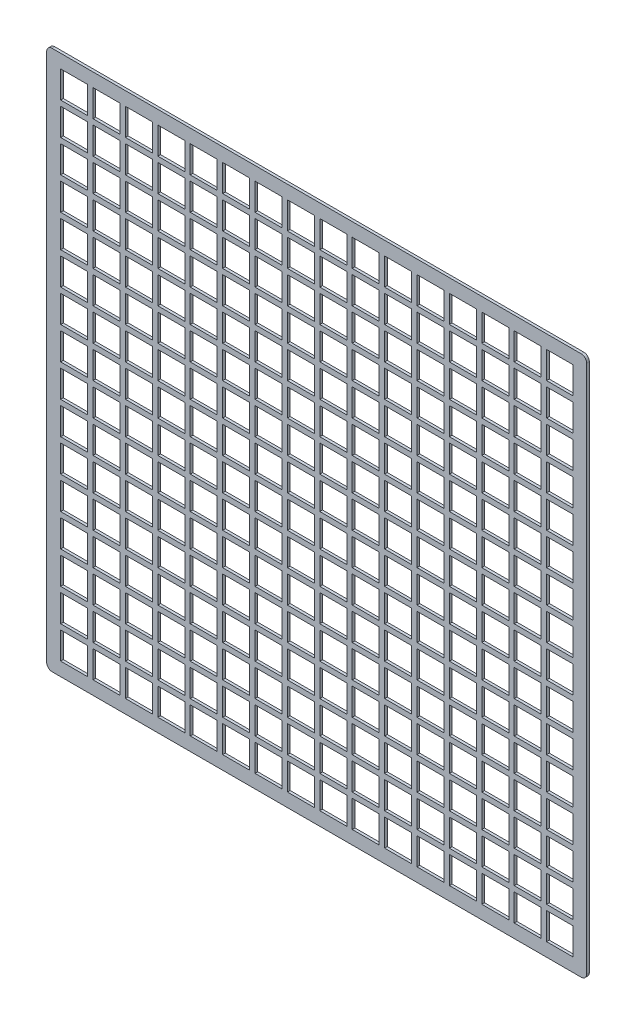
from build123d import *

# Parameters (mm, degrees)
MODEL_W             = 0.5
MODEL_H             = 0.499061554
MODEL_H_2           = 0.5
MODEL_W_2           = 0.491377323
BOSS_EXTRUDE1_DEPTH = 0.05


with BuildPart() as part:
    # Model → Boss-Extrude1 (new body)
    with BuildSketch(Plane.XY):
        with BuildLine():
            Line((0.1, 0), (9.9, 0))
            ThreePointArc((9.9, 0), (9.970710678, 0.029289322), (10, 0.1))
            Line((10, 0.1), (10, 9.9))
            ThreePointArc((10, 9.9), (9.970710678, 9.970710678), (9.9, 10))
            Line((9.9, 10), (0.1, 10))
            ThreePointArc((0.1, 10), (0.029289322, 9.970710678), (0, 9.9))
            Line((0, 9.9), (0, 0.1))
            ThreePointArc((0, 0.1), (0.029289322, 0.029289322), (0.1, 0))
        make_face()
        with Locations((0.508622677, 0.499530777)):
            Rectangle(MODEL_W, MODEL_H, mode=Mode.SUBTRACT)
        with Locations((0.508622677, 1.099061554)):
            Rectangle(MODEL_W, MODEL_H_2, mode=Mode.SUBTRACT)
        with Locations((0.508622677, 1.699061554)):
            Rectangle(MODEL_W, MODEL_H_2, mode=Mode.SUBTRACT)
        with Locations((0.508622677, 2.299061554)):
            Rectangle(MODEL_W, MODEL_H_2, mode=Mode.SUBTRACT)
        with Locations((0.508622677, 2.899061554)):
            Rectangle(MODEL_W, MODEL_H_2, mode=Mode.SUBTRACT)
        with Locations((0.508622677, 3.499061554)):
            Rectangle(MODEL_W, MODEL_H_2, mode=Mode.SUBTRACT)
        with Locations((0.508622677, 4.099061554)):
            Rectangle(MODEL_W, MODEL_H_2, mode=Mode.SUBTRACT)
        with Locations((0.508622677, 4.699061554)):
            Rectangle(MODEL_W, MODEL_H_2, mode=Mode.SUBTRACT)
        with Locations((0.508622677, 5.299061554)):
            Rectangle(MODEL_W, MODEL_H_2, mode=Mode.SUBTRACT)
        with Locations((0.508622677, 5.899061554)):
            Rectangle(MODEL_W, MODEL_H_2, mode=Mode.SUBTRACT)
        with Locations((0.508622677, 6.499061554)):
            Rectangle(MODEL_W, MODEL_H_2, mode=Mode.SUBTRACT)
        with Locations((0.508622677, 7.099061554)):
            Rectangle(MODEL_W, MODEL_H_2, mode=Mode.SUBTRACT)
        with Locations((0.508622677, 7.699061554)):
            Rectangle(MODEL_W, MODEL_H_2, mode=Mode.SUBTRACT)
        with Locations((0.508622677, 8.299061554)):
            Rectangle(MODEL_W, MODEL_H_2, mode=Mode.SUBTRACT)
        with Locations((0.508622677, 8.899061554)):
            Rectangle(MODEL_W, MODEL_H_2, mode=Mode.SUBTRACT)
        with Locations((0.508622677, 9.499061554)):
            Rectangle(MODEL_W, MODEL_H_2, mode=Mode.SUBTRACT)
        with Locations((1.108622677, 0.499530777)):
            Rectangle(MODEL_W, MODEL_H, mode=Mode.SUBTRACT)
        with Locations((1.108622677, 1.099061554)):
            Rectangle(MODEL_W, MODEL_H_2, mode=Mode.SUBTRACT)
        with Locations((1.108622677, 1.699061554)):
            Rectangle(MODEL_W, MODEL_H_2, mode=Mode.SUBTRACT)
        with Locations((1.108622677, 2.299061554)):
            Rectangle(MODEL_W, MODEL_H_2, mode=Mode.SUBTRACT)
        with Locations((1.108622677, 2.899061554)):
            Rectangle(MODEL_W, MODEL_H_2, mode=Mode.SUBTRACT)
        with Locations((1.108622677, 3.499061554)):
            Rectangle(MODEL_W, MODEL_H_2, mode=Mode.SUBTRACT)
        with Locations((1.108622677, 4.099061554)):
            Rectangle(MODEL_W, MODEL_H_2, mode=Mode.SUBTRACT)
        with Locations((1.108622677, 4.699061554)):
            Rectangle(MODEL_W, MODEL_H_2, mode=Mode.SUBTRACT)
        with Locations((1.108622677, 5.299061554)):
            Rectangle(MODEL_W, MODEL_H_2, mode=Mode.SUBTRACT)
        with Locations((1.108622677, 5.899061554)):
            Rectangle(MODEL_W, MODEL_H_2, mode=Mode.SUBTRACT)
        with Locations((1.108622677, 6.499061554)):
            Rectangle(MODEL_W, MODEL_H_2, mode=Mode.SUBTRACT)
        with Locations((1.108622677, 7.099061554)):
            Rectangle(MODEL_W, MODEL_H_2, mode=Mode.SUBTRACT)
        with Locations((1.108622677, 7.699061554)):
            Rectangle(MODEL_W, MODEL_H_2, mode=Mode.SUBTRACT)
        with Locations((1.108622677, 8.299061554)):
            Rectangle(MODEL_W, MODEL_H_2, mode=Mode.SUBTRACT)
        with Locations((1.108622677, 8.899061554)):
            Rectangle(MODEL_W, MODEL_H_2, mode=Mode.SUBTRACT)
        with Locations((1.108622677, 9.499061554)):
            Rectangle(MODEL_W, MODEL_H_2, mode=Mode.SUBTRACT)
        with Locations((1.708622677, 0.499530777)):
            Rectangle(MODEL_W, MODEL_H, mode=Mode.SUBTRACT)
        with Locations((1.708622677, 1.099061554)):
            Rectangle(MODEL_W, MODEL_H_2, mode=Mode.SUBTRACT)
        with Locations((1.708622677, 1.699061554)):
            Rectangle(MODEL_W, MODEL_H_2, mode=Mode.SUBTRACT)
        with Locations((1.708622677, 2.299061554)):
            Rectangle(MODEL_W, MODEL_H_2, mode=Mode.SUBTRACT)
        with Locations((1.708622677, 2.899061554)):
            Rectangle(MODEL_W, MODEL_H_2, mode=Mode.SUBTRACT)
        with Locations((1.708622677, 3.499061554)):
            Rectangle(MODEL_W, MODEL_H_2, mode=Mode.SUBTRACT)
        with Locations((1.708622677, 4.099061554)):
            Rectangle(MODEL_W, MODEL_H_2, mode=Mode.SUBTRACT)
        with Locations((1.708622677, 4.699061554)):
            Rectangle(MODEL_W, MODEL_H_2, mode=Mode.SUBTRACT)
        with Locations((1.708622677, 5.299061554)):
            Rectangle(MODEL_W, MODEL_H_2, mode=Mode.SUBTRACT)
        with Locations((1.708622677, 5.899061554)):
            Rectangle(MODEL_W, MODEL_H_2, mode=Mode.SUBTRACT)
        with Locations((1.708622677, 6.499061554)):
            Rectangle(MODEL_W, MODEL_H_2, mode=Mode.SUBTRACT)
        with Locations((1.708622677, 7.099061554)):
            Rectangle(MODEL_W, MODEL_H_2, mode=Mode.SUBTRACT)
        with Locations((1.708622677, 7.699061554)):
            Rectangle(MODEL_W, MODEL_H_2, mode=Mode.SUBTRACT)
        with Locations((1.708622677, 8.299061554)):
            Rectangle(MODEL_W, MODEL_H_2, mode=Mode.SUBTRACT)
        with Locations((1.708622677, 8.899061554)):
            Rectangle(MODEL_W, MODEL_H_2, mode=Mode.SUBTRACT)
        with Locations((1.708622677, 9.499061554)):
            Rectangle(MODEL_W, MODEL_H_2, mode=Mode.SUBTRACT)
        with Locations((2.308622677, 0.499530777)):
            Rectangle(MODEL_W, MODEL_H, mode=Mode.SUBTRACT)
        with Locations((2.308622677, 1.099061554)):
            Rectangle(MODEL_W, MODEL_H_2, mode=Mode.SUBTRACT)
        with Locations((2.308622677, 1.699061554)):
            Rectangle(MODEL_W, MODEL_H_2, mode=Mode.SUBTRACT)
        with Locations((2.308622677, 2.299061554)):
            Rectangle(MODEL_W, MODEL_H_2, mode=Mode.SUBTRACT)
        with Locations((2.308622677, 2.899061554)):
            Rectangle(MODEL_W, MODEL_H_2, mode=Mode.SUBTRACT)
        with Locations((2.308622677, 3.499061554)):
            Rectangle(MODEL_W, MODEL_H_2, mode=Mode.SUBTRACT)
        with Locations((2.308622677, 4.099061554)):
            Rectangle(MODEL_W, MODEL_H_2, mode=Mode.SUBTRACT)
        with Locations((2.308622677, 4.699061554)):
            Rectangle(MODEL_W, MODEL_H_2, mode=Mode.SUBTRACT)
        with Locations((2.308622677, 5.299061554)):
            Rectangle(MODEL_W, MODEL_H_2, mode=Mode.SUBTRACT)
        with Locations((2.308622677, 5.899061554)):
            Rectangle(MODEL_W, MODEL_H_2, mode=Mode.SUBTRACT)
        with Locations((2.308622677, 6.499061554)):
            Rectangle(MODEL_W, MODEL_H_2, mode=Mode.SUBTRACT)
        with Locations((2.308622677, 7.099061554)):
            Rectangle(MODEL_W, MODEL_H_2, mode=Mode.SUBTRACT)
        with Locations((2.308622677, 7.699061554)):
            Rectangle(MODEL_W, MODEL_H_2, mode=Mode.SUBTRACT)
        with Locations((2.308622677, 8.299061554)):
            Rectangle(MODEL_W, MODEL_H_2, mode=Mode.SUBTRACT)
        with Locations((2.308622677, 8.899061554)):
            Rectangle(MODEL_W, MODEL_H_2, mode=Mode.SUBTRACT)
        with Locations((2.308622677, 9.499061554)):
            Rectangle(MODEL_W, MODEL_H_2, mode=Mode.SUBTRACT)
        with Locations((2.908622677, 0.499530777)):
            Rectangle(MODEL_W, MODEL_H, mode=Mode.SUBTRACT)
        with Locations((2.908622677, 1.099061554)):
            Rectangle(MODEL_W, MODEL_H_2, mode=Mode.SUBTRACT)
        with Locations((2.908622677, 1.699061554)):
            Rectangle(MODEL_W, MODEL_H_2, mode=Mode.SUBTRACT)
        with Locations((2.908622677, 2.299061554)):
            Rectangle(MODEL_W, MODEL_H_2, mode=Mode.SUBTRACT)
        with Locations((2.908622677, 2.899061554)):
            Rectangle(MODEL_W, MODEL_H_2, mode=Mode.SUBTRACT)
        with Locations((2.908622677, 3.499061554)):
            Rectangle(MODEL_W, MODEL_H_2, mode=Mode.SUBTRACT)
        with Locations((2.908622677, 4.099061554)):
            Rectangle(MODEL_W, MODEL_H_2, mode=Mode.SUBTRACT)
        with Locations((2.908622677, 4.699061554)):
            Rectangle(MODEL_W, MODEL_H_2, mode=Mode.SUBTRACT)
        with Locations((2.908622677, 5.299061554)):
            Rectangle(MODEL_W, MODEL_H_2, mode=Mode.SUBTRACT)
        with Locations((2.908622677, 5.899061554)):
            Rectangle(MODEL_W, MODEL_H_2, mode=Mode.SUBTRACT)
        with Locations((2.908622677, 6.499061554)):
            Rectangle(MODEL_W, MODEL_H_2, mode=Mode.SUBTRACT)
        with Locations((2.908622677, 7.099061554)):
            Rectangle(MODEL_W, MODEL_H_2, mode=Mode.SUBTRACT)
        with Locations((2.908622677, 7.699061554)):
            Rectangle(MODEL_W, MODEL_H_2, mode=Mode.SUBTRACT)
        with Locations((2.908622677, 8.299061554)):
            Rectangle(MODEL_W, MODEL_H_2, mode=Mode.SUBTRACT)
        with Locations((2.908622677, 8.899061554)):
            Rectangle(MODEL_W, MODEL_H_2, mode=Mode.SUBTRACT)
        with Locations((2.908622677, 9.499061554)):
            Rectangle(MODEL_W, MODEL_H_2, mode=Mode.SUBTRACT)
        with Locations((3.508622677, 0.499530777)):
            Rectangle(MODEL_W, MODEL_H, mode=Mode.SUBTRACT)
        with Locations((3.508622677, 1.099061554)):
            Rectangle(MODEL_W, MODEL_H_2, mode=Mode.SUBTRACT)
        with Locations((3.508622677, 1.699061554)):
            Rectangle(MODEL_W, MODEL_H_2, mode=Mode.SUBTRACT)
        with Locations((3.508622677, 2.299061554)):
            Rectangle(MODEL_W, MODEL_H_2, mode=Mode.SUBTRACT)
        with Locations((3.508622677, 2.899061554)):
            Rectangle(MODEL_W, MODEL_H_2, mode=Mode.SUBTRACT)
        with Locations((3.508622677, 3.499061554)):
            Rectangle(MODEL_W, MODEL_H_2, mode=Mode.SUBTRACT)
        with Locations((3.508622677, 4.099061554)):
            Rectangle(MODEL_W, MODEL_H_2, mode=Mode.SUBTRACT)
        with Locations((3.508622677, 4.699061554)):
            Rectangle(MODEL_W, MODEL_H_2, mode=Mode.SUBTRACT)
        with Locations((3.508622677, 5.299061554)):
            Rectangle(MODEL_W, MODEL_H_2, mode=Mode.SUBTRACT)
        with Locations((3.508622677, 5.899061554)):
            Rectangle(MODEL_W, MODEL_H_2, mode=Mode.SUBTRACT)
        with Locations((3.508622677, 6.499061554)):
            Rectangle(MODEL_W, MODEL_H_2, mode=Mode.SUBTRACT)
        with Locations((3.508622677, 7.099061554)):
            Rectangle(MODEL_W, MODEL_H_2, mode=Mode.SUBTRACT)
        with Locations((3.508622677, 7.699061554)):
            Rectangle(MODEL_W, MODEL_H_2, mode=Mode.SUBTRACT)
        with Locations((3.508622677, 8.299061554)):
            Rectangle(MODEL_W, MODEL_H_2, mode=Mode.SUBTRACT)
        with Locations((3.508622677, 8.899061554)):
            Rectangle(MODEL_W, MODEL_H_2, mode=Mode.SUBTRACT)
        with Locations((3.508622677, 9.499061554)):
            Rectangle(MODEL_W, MODEL_H_2, mode=Mode.SUBTRACT)
        with Locations((4.108622677, 0.499530777)):
            Rectangle(MODEL_W, MODEL_H, mode=Mode.SUBTRACT)
        with Locations((4.108622677, 1.099061554)):
            Rectangle(MODEL_W, MODEL_H_2, mode=Mode.SUBTRACT)
        with Locations((4.108622677, 1.699061554)):
            Rectangle(MODEL_W, MODEL_H_2, mode=Mode.SUBTRACT)
        with Locations((4.108622677, 2.299061554)):
            Rectangle(MODEL_W, MODEL_H_2, mode=Mode.SUBTRACT)
        with Locations((4.108622677, 2.899061554)):
            Rectangle(MODEL_W, MODEL_H_2, mode=Mode.SUBTRACT)
        with Locations((4.108622677, 3.499061554)):
            Rectangle(MODEL_W, MODEL_H_2, mode=Mode.SUBTRACT)
        with Locations((4.108622677, 4.099061554)):
            Rectangle(MODEL_W, MODEL_H_2, mode=Mode.SUBTRACT)
        with Locations((4.108622677, 4.699061554)):
            Rectangle(MODEL_W, MODEL_H_2, mode=Mode.SUBTRACT)
        with Locations((4.108622677, 5.299061554)):
            Rectangle(MODEL_W, MODEL_H_2, mode=Mode.SUBTRACT)
        with Locations((4.108622677, 5.899061554)):
            Rectangle(MODEL_W, MODEL_H_2, mode=Mode.SUBTRACT)
        with Locations((4.108622677, 6.499061554)):
            Rectangle(MODEL_W, MODEL_H_2, mode=Mode.SUBTRACT)
        with Locations((4.108622677, 7.099061554)):
            Rectangle(MODEL_W, MODEL_H_2, mode=Mode.SUBTRACT)
        with Locations((4.108622677, 7.699061554)):
            Rectangle(MODEL_W, MODEL_H_2, mode=Mode.SUBTRACT)
        with Locations((4.108622677, 8.299061554)):
            Rectangle(MODEL_W, MODEL_H_2, mode=Mode.SUBTRACT)
        with Locations((4.108622677, 8.899061554)):
            Rectangle(MODEL_W, MODEL_H_2, mode=Mode.SUBTRACT)
        with Locations((4.108622677, 9.499061554)):
            Rectangle(MODEL_W, MODEL_H_2, mode=Mode.SUBTRACT)
        with Locations((4.708622677, 0.499530777)):
            Rectangle(MODEL_W, MODEL_H, mode=Mode.SUBTRACT)
        with Locations((4.708622677, 1.099061554)):
            Rectangle(MODEL_W, MODEL_H_2, mode=Mode.SUBTRACT)
        with Locations((4.708622677, 1.699061554)):
            Rectangle(MODEL_W, MODEL_H_2, mode=Mode.SUBTRACT)
        with Locations((4.708622677, 2.299061554)):
            Rectangle(MODEL_W, MODEL_H_2, mode=Mode.SUBTRACT)
        with Locations((4.708622677, 2.899061554)):
            Rectangle(MODEL_W, MODEL_H_2, mode=Mode.SUBTRACT)
        with Locations((4.708622677, 3.499061554)):
            Rectangle(MODEL_W, MODEL_H_2, mode=Mode.SUBTRACT)
        with Locations((4.708622677, 4.099061554)):
            Rectangle(MODEL_W, MODEL_H_2, mode=Mode.SUBTRACT)
        with Locations((4.708622677, 4.699061554)):
            Rectangle(MODEL_W, MODEL_H_2, mode=Mode.SUBTRACT)
        with Locations((4.708622677, 5.299061554)):
            Rectangle(MODEL_W, MODEL_H_2, mode=Mode.SUBTRACT)
        with Locations((4.708622677, 5.899061554)):
            Rectangle(MODEL_W, MODEL_H_2, mode=Mode.SUBTRACT)
        with Locations((4.708622677, 6.499061554)):
            Rectangle(MODEL_W, MODEL_H_2, mode=Mode.SUBTRACT)
        with Locations((4.708622677, 7.099061554)):
            Rectangle(MODEL_W, MODEL_H_2, mode=Mode.SUBTRACT)
        with Locations((4.708622677, 7.699061554)):
            Rectangle(MODEL_W, MODEL_H_2, mode=Mode.SUBTRACT)
        with Locations((4.708622677, 8.299061554)):
            Rectangle(MODEL_W, MODEL_H_2, mode=Mode.SUBTRACT)
        with Locations((4.708622677, 8.899061554)):
            Rectangle(MODEL_W, MODEL_H_2, mode=Mode.SUBTRACT)
        with Locations((4.708622677, 9.499061554)):
            Rectangle(MODEL_W, MODEL_H_2, mode=Mode.SUBTRACT)
        with Locations((5.308622677, 0.499530777)):
            Rectangle(MODEL_W, MODEL_H, mode=Mode.SUBTRACT)
        with Locations((5.308622677, 1.099061554)):
            Rectangle(MODEL_W, MODEL_H_2, mode=Mode.SUBTRACT)
        with Locations((5.308622677, 1.699061554)):
            Rectangle(MODEL_W, MODEL_H_2, mode=Mode.SUBTRACT)
        with Locations((5.308622677, 2.299061554)):
            Rectangle(MODEL_W, MODEL_H_2, mode=Mode.SUBTRACT)
        with Locations((5.308622677, 2.899061554)):
            Rectangle(MODEL_W, MODEL_H_2, mode=Mode.SUBTRACT)
        with Locations((5.308622677, 3.499061554)):
            Rectangle(MODEL_W, MODEL_H_2, mode=Mode.SUBTRACT)
        with Locations((5.308622677, 4.099061554)):
            Rectangle(MODEL_W, MODEL_H_2, mode=Mode.SUBTRACT)
        with Locations((5.308622677, 4.699061554)):
            Rectangle(MODEL_W, MODEL_H_2, mode=Mode.SUBTRACT)
        with Locations((5.308622677, 5.299061554)):
            Rectangle(MODEL_W, MODEL_H_2, mode=Mode.SUBTRACT)
        with Locations((5.308622677, 5.899061554)):
            Rectangle(MODEL_W, MODEL_H_2, mode=Mode.SUBTRACT)
        with Locations((5.308622677, 6.499061554)):
            Rectangle(MODEL_W, MODEL_H_2, mode=Mode.SUBTRACT)
        with Locations((5.308622677, 7.099061554)):
            Rectangle(MODEL_W, MODEL_H_2, mode=Mode.SUBTRACT)
        with Locations((5.308622677, 7.699061554)):
            Rectangle(MODEL_W, MODEL_H_2, mode=Mode.SUBTRACT)
        with Locations((5.308622677, 8.299061554)):
            Rectangle(MODEL_W, MODEL_H_2, mode=Mode.SUBTRACT)
        with Locations((5.308622677, 8.899061554)):
            Rectangle(MODEL_W, MODEL_H_2, mode=Mode.SUBTRACT)
        with Locations((5.308622677, 9.499061554)):
            Rectangle(MODEL_W, MODEL_H_2, mode=Mode.SUBTRACT)
        with Locations((5.908622677, 0.499530777)):
            Rectangle(MODEL_W, MODEL_H, mode=Mode.SUBTRACT)
        with Locations((5.908622677, 1.099061554)):
            Rectangle(MODEL_W, MODEL_H_2, mode=Mode.SUBTRACT)
        with Locations((5.908622677, 1.699061554)):
            Rectangle(MODEL_W, MODEL_H_2, mode=Mode.SUBTRACT)
        with Locations((5.908622677, 2.299061554)):
            Rectangle(MODEL_W, MODEL_H_2, mode=Mode.SUBTRACT)
        with Locations((5.908622677, 2.899061554)):
            Rectangle(MODEL_W, MODEL_H_2, mode=Mode.SUBTRACT)
        with Locations((5.908622677, 3.499061554)):
            Rectangle(MODEL_W, MODEL_H_2, mode=Mode.SUBTRACT)
        with Locations((5.908622677, 4.099061554)):
            Rectangle(MODEL_W, MODEL_H_2, mode=Mode.SUBTRACT)
        with Locations((5.908622677, 4.699061554)):
            Rectangle(MODEL_W, MODEL_H_2, mode=Mode.SUBTRACT)
        with Locations((5.908622677, 5.299061554)):
            Rectangle(MODEL_W, MODEL_H_2, mode=Mode.SUBTRACT)
        with Locations((5.908622677, 5.899061554)):
            Rectangle(MODEL_W, MODEL_H_2, mode=Mode.SUBTRACT)
        with Locations((5.908622677, 6.499061554)):
            Rectangle(MODEL_W, MODEL_H_2, mode=Mode.SUBTRACT)
        with Locations((5.908622677, 7.099061554)):
            Rectangle(MODEL_W, MODEL_H_2, mode=Mode.SUBTRACT)
        with Locations((5.908622677, 7.699061554)):
            Rectangle(MODEL_W, MODEL_H_2, mode=Mode.SUBTRACT)
        with Locations((5.908622677, 8.299061554)):
            Rectangle(MODEL_W, MODEL_H_2, mode=Mode.SUBTRACT)
        with Locations((5.908622677, 8.899061554)):
            Rectangle(MODEL_W, MODEL_H_2, mode=Mode.SUBTRACT)
        with Locations((5.908622677, 9.499061554)):
            Rectangle(MODEL_W, MODEL_H_2, mode=Mode.SUBTRACT)
        with Locations((6.508622677, 0.499530777)):
            Rectangle(MODEL_W, MODEL_H, mode=Mode.SUBTRACT)
        with Locations((6.508622677, 1.099061554)):
            Rectangle(MODEL_W, MODEL_H_2, mode=Mode.SUBTRACT)
        with Locations((6.508622677, 1.699061554)):
            Rectangle(MODEL_W, MODEL_H_2, mode=Mode.SUBTRACT)
        with Locations((6.508622677, 2.299061554)):
            Rectangle(MODEL_W, MODEL_H_2, mode=Mode.SUBTRACT)
        with Locations((6.508622677, 2.899061554)):
            Rectangle(MODEL_W, MODEL_H_2, mode=Mode.SUBTRACT)
        with Locations((6.508622677, 3.499061554)):
            Rectangle(MODEL_W, MODEL_H_2, mode=Mode.SUBTRACT)
        with Locations((6.508622677, 4.099061554)):
            Rectangle(MODEL_W, MODEL_H_2, mode=Mode.SUBTRACT)
        with Locations((6.508622677, 4.699061554)):
            Rectangle(MODEL_W, MODEL_H_2, mode=Mode.SUBTRACT)
        with Locations((6.508622677, 5.299061554)):
            Rectangle(MODEL_W, MODEL_H_2, mode=Mode.SUBTRACT)
        with Locations((6.508622677, 5.899061554)):
            Rectangle(MODEL_W, MODEL_H_2, mode=Mode.SUBTRACT)
        with Locations((6.508622677, 6.499061554)):
            Rectangle(MODEL_W, MODEL_H_2, mode=Mode.SUBTRACT)
        with Locations((6.508622677, 7.099061554)):
            Rectangle(MODEL_W, MODEL_H_2, mode=Mode.SUBTRACT)
        with Locations((6.508622677, 7.699061554)):
            Rectangle(MODEL_W, MODEL_H_2, mode=Mode.SUBTRACT)
        with Locations((6.508622677, 8.299061554)):
            Rectangle(MODEL_W, MODEL_H_2, mode=Mode.SUBTRACT)
        with Locations((6.508622677, 8.899061554)):
            Rectangle(MODEL_W, MODEL_H_2, mode=Mode.SUBTRACT)
        with Locations((6.508622677, 9.499061554)):
            Rectangle(MODEL_W, MODEL_H_2, mode=Mode.SUBTRACT)
        with Locations((7.108622677, 0.499530777)):
            Rectangle(MODEL_W, MODEL_H, mode=Mode.SUBTRACT)
        with Locations((7.108622677, 1.099061554)):
            Rectangle(MODEL_W, MODEL_H_2, mode=Mode.SUBTRACT)
        with Locations((7.108622677, 1.699061554)):
            Rectangle(MODEL_W, MODEL_H_2, mode=Mode.SUBTRACT)
        with Locations((7.108622677, 2.299061554)):
            Rectangle(MODEL_W, MODEL_H_2, mode=Mode.SUBTRACT)
        with Locations((7.108622677, 2.899061554)):
            Rectangle(MODEL_W, MODEL_H_2, mode=Mode.SUBTRACT)
        with Locations((7.108622677, 3.499061554)):
            Rectangle(MODEL_W, MODEL_H_2, mode=Mode.SUBTRACT)
        with Locations((7.108622677, 4.099061554)):
            Rectangle(MODEL_W, MODEL_H_2, mode=Mode.SUBTRACT)
        with Locations((7.108622677, 4.699061554)):
            Rectangle(MODEL_W, MODEL_H_2, mode=Mode.SUBTRACT)
        with Locations((7.108622677, 5.299061554)):
            Rectangle(MODEL_W, MODEL_H_2, mode=Mode.SUBTRACT)
        with Locations((7.108622677, 5.899061554)):
            Rectangle(MODEL_W, MODEL_H_2, mode=Mode.SUBTRACT)
        with Locations((7.108622677, 6.499061554)):
            Rectangle(MODEL_W, MODEL_H_2, mode=Mode.SUBTRACT)
        with Locations((7.108622677, 7.099061554)):
            Rectangle(MODEL_W, MODEL_H_2, mode=Mode.SUBTRACT)
        with Locations((7.108622677, 7.699061554)):
            Rectangle(MODEL_W, MODEL_H_2, mode=Mode.SUBTRACT)
        with Locations((7.108622677, 8.299061554)):
            Rectangle(MODEL_W, MODEL_H_2, mode=Mode.SUBTRACT)
        with Locations((7.108622677, 8.899061554)):
            Rectangle(MODEL_W, MODEL_H_2, mode=Mode.SUBTRACT)
        with Locations((7.108622677, 9.499061554)):
            Rectangle(MODEL_W, MODEL_H_2, mode=Mode.SUBTRACT)
        with Locations((7.708622677, 0.499530777)):
            Rectangle(MODEL_W, MODEL_H, mode=Mode.SUBTRACT)
        with Locations((7.708622677, 1.099061554)):
            Rectangle(MODEL_W, MODEL_H_2, mode=Mode.SUBTRACT)
        with Locations((7.708622677, 1.699061554)):
            Rectangle(MODEL_W, MODEL_H_2, mode=Mode.SUBTRACT)
        with Locations((7.708622677, 2.299061554)):
            Rectangle(MODEL_W, MODEL_H_2, mode=Mode.SUBTRACT)
        with Locations((7.708622677, 2.899061554)):
            Rectangle(MODEL_W, MODEL_H_2, mode=Mode.SUBTRACT)
        with Locations((7.708622677, 3.499061554)):
            Rectangle(MODEL_W, MODEL_H_2, mode=Mode.SUBTRACT)
        with Locations((7.708622677, 4.099061554)):
            Rectangle(MODEL_W, MODEL_H_2, mode=Mode.SUBTRACT)
        with Locations((7.708622677, 4.699061554)):
            Rectangle(MODEL_W, MODEL_H_2, mode=Mode.SUBTRACT)
        with Locations((7.708622677, 5.299061554)):
            Rectangle(MODEL_W, MODEL_H_2, mode=Mode.SUBTRACT)
        with Locations((7.708622677, 5.899061554)):
            Rectangle(MODEL_W, MODEL_H_2, mode=Mode.SUBTRACT)
        with Locations((7.708622677, 6.499061554)):
            Rectangle(MODEL_W, MODEL_H_2, mode=Mode.SUBTRACT)
        with Locations((7.708622677, 7.099061554)):
            Rectangle(MODEL_W, MODEL_H_2, mode=Mode.SUBTRACT)
        with Locations((7.708622677, 7.699061554)):
            Rectangle(MODEL_W, MODEL_H_2, mode=Mode.SUBTRACT)
        with Locations((7.708622677, 8.299061554)):
            Rectangle(MODEL_W, MODEL_H_2, mode=Mode.SUBTRACT)
        with Locations((7.708622677, 8.899061554)):
            Rectangle(MODEL_W, MODEL_H_2, mode=Mode.SUBTRACT)
        with Locations((7.708622677, 9.499061554)):
            Rectangle(MODEL_W, MODEL_H_2, mode=Mode.SUBTRACT)
        with Locations((8.308622677, 0.499530777)):
            Rectangle(MODEL_W, MODEL_H, mode=Mode.SUBTRACT)
        with Locations((8.308622677, 1.099061554)):
            Rectangle(MODEL_W, MODEL_H_2, mode=Mode.SUBTRACT)
        with Locations((8.308622677, 1.699061554)):
            Rectangle(MODEL_W, MODEL_H_2, mode=Mode.SUBTRACT)
        with Locations((8.308622677, 2.299061554)):
            Rectangle(MODEL_W, MODEL_H_2, mode=Mode.SUBTRACT)
        with Locations((8.308622677, 2.899061554)):
            Rectangle(MODEL_W, MODEL_H_2, mode=Mode.SUBTRACT)
        with Locations((8.308622677, 3.499061554)):
            Rectangle(MODEL_W, MODEL_H_2, mode=Mode.SUBTRACT)
        with Locations((8.308622677, 4.099061554)):
            Rectangle(MODEL_W, MODEL_H_2, mode=Mode.SUBTRACT)
        with Locations((8.308622677, 4.699061554)):
            Rectangle(MODEL_W, MODEL_H_2, mode=Mode.SUBTRACT)
        with Locations((8.308622677, 5.299061554)):
            Rectangle(MODEL_W, MODEL_H_2, mode=Mode.SUBTRACT)
        with Locations((8.308622677, 5.899061554)):
            Rectangle(MODEL_W, MODEL_H_2, mode=Mode.SUBTRACT)
        with Locations((8.308622677, 6.499061554)):
            Rectangle(MODEL_W, MODEL_H_2, mode=Mode.SUBTRACT)
        with Locations((8.308622677, 7.099061554)):
            Rectangle(MODEL_W, MODEL_H_2, mode=Mode.SUBTRACT)
        with Locations((8.308622677, 7.699061554)):
            Rectangle(MODEL_W, MODEL_H_2, mode=Mode.SUBTRACT)
        with Locations((8.308622677, 8.299061554)):
            Rectangle(MODEL_W, MODEL_H_2, mode=Mode.SUBTRACT)
        with Locations((8.308622677, 8.899061554)):
            Rectangle(MODEL_W, MODEL_H_2, mode=Mode.SUBTRACT)
        with Locations((8.308622677, 9.499061554)):
            Rectangle(MODEL_W, MODEL_H_2, mode=Mode.SUBTRACT)
        with Locations((8.908622677, 0.499530777)):
            Rectangle(MODEL_W, MODEL_H, mode=Mode.SUBTRACT)
        with Locations((8.908622677, 1.099061554)):
            Rectangle(MODEL_W, MODEL_H_2, mode=Mode.SUBTRACT)
        with Locations((8.908622677, 1.699061554)):
            Rectangle(MODEL_W, MODEL_H_2, mode=Mode.SUBTRACT)
        with Locations((8.908622677, 2.299061554)):
            Rectangle(MODEL_W, MODEL_H_2, mode=Mode.SUBTRACT)
        with Locations((8.908622677, 2.899061554)):
            Rectangle(MODEL_W, MODEL_H_2, mode=Mode.SUBTRACT)
        with Locations((8.908622677, 3.499061554)):
            Rectangle(MODEL_W, MODEL_H_2, mode=Mode.SUBTRACT)
        with Locations((8.908622677, 4.099061554)):
            Rectangle(MODEL_W, MODEL_H_2, mode=Mode.SUBTRACT)
        with Locations((8.908622677, 4.699061554)):
            Rectangle(MODEL_W, MODEL_H_2, mode=Mode.SUBTRACT)
        with Locations((8.908622677, 5.299061554)):
            Rectangle(MODEL_W, MODEL_H_2, mode=Mode.SUBTRACT)
        with Locations((8.908622677, 5.899061554)):
            Rectangle(MODEL_W, MODEL_H_2, mode=Mode.SUBTRACT)
        with Locations((8.908622677, 6.499061554)):
            Rectangle(MODEL_W, MODEL_H_2, mode=Mode.SUBTRACT)
        with Locations((8.908622677, 7.099061554)):
            Rectangle(MODEL_W, MODEL_H_2, mode=Mode.SUBTRACT)
        with Locations((8.908622677, 7.699061554)):
            Rectangle(MODEL_W, MODEL_H_2, mode=Mode.SUBTRACT)
        with Locations((8.908622677, 8.299061554)):
            Rectangle(MODEL_W, MODEL_H_2, mode=Mode.SUBTRACT)
        with Locations((8.908622677, 8.899061554)):
            Rectangle(MODEL_W, MODEL_H_2, mode=Mode.SUBTRACT)
        with Locations((8.908622677, 9.499061554)):
            Rectangle(MODEL_W, MODEL_H_2, mode=Mode.SUBTRACT)
        with Locations((9.504311338, 0.499530777)):
            Rectangle(MODEL_W_2, MODEL_H, mode=Mode.SUBTRACT)
        with Locations((9.504311338, 1.099061554)):
            Rectangle(MODEL_W_2, MODEL_H_2, mode=Mode.SUBTRACT)
        with Locations((9.504311338, 1.699061554)):
            Rectangle(MODEL_W_2, MODEL_H_2, mode=Mode.SUBTRACT)
        with Locations((9.504311338, 2.299061554)):
            Rectangle(MODEL_W_2, MODEL_H_2, mode=Mode.SUBTRACT)
        with Locations((9.504311338, 2.899061554)):
            Rectangle(MODEL_W_2, MODEL_H_2, mode=Mode.SUBTRACT)
        with Locations((9.504311338, 3.499061554)):
            Rectangle(MODEL_W_2, MODEL_H_2, mode=Mode.SUBTRACT)
        with Locations((9.504311338, 4.099061554)):
            Rectangle(MODEL_W_2, MODEL_H_2, mode=Mode.SUBTRACT)
        with Locations((9.504311338, 4.699061554)):
            Rectangle(MODEL_W_2, MODEL_H_2, mode=Mode.SUBTRACT)
        with Locations((9.504311338, 5.299061554)):
            Rectangle(MODEL_W_2, MODEL_H_2, mode=Mode.SUBTRACT)
        with Locations((9.504311338, 5.899061554)):
            Rectangle(MODEL_W_2, MODEL_H_2, mode=Mode.SUBTRACT)
        with Locations((9.504311338, 6.499061554)):
            Rectangle(MODEL_W_2, MODEL_H_2, mode=Mode.SUBTRACT)
        with Locations((9.504311338, 7.099061554)):
            Rectangle(MODEL_W_2, MODEL_H_2, mode=Mode.SUBTRACT)
        with Locations((9.504311338, 7.699061554)):
            Rectangle(MODEL_W_2, MODEL_H_2, mode=Mode.SUBTRACT)
        with Locations((9.504311338, 8.299061554)):
            Rectangle(MODEL_W_2, MODEL_H_2, mode=Mode.SUBTRACT)
        with Locations((9.504311338, 8.899061554)):
            Rectangle(MODEL_W_2, MODEL_H_2, mode=Mode.SUBTRACT)
        with Locations((9.504311338, 9.499061554)):
            Rectangle(MODEL_W_2, MODEL_H_2, mode=Mode.SUBTRACT)
    extrude(amount=BOSS_EXTRUDE1_DEPTH)


solid = part.part
